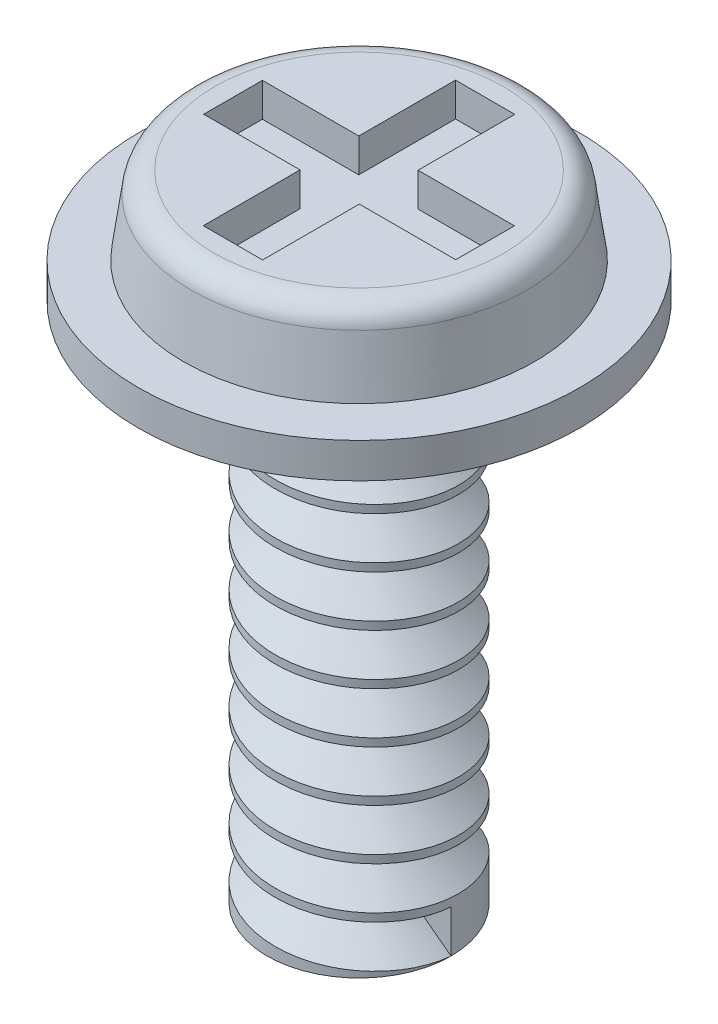
from build123d import *

# Parameters (mm, degrees)
SKETCH1_R           = 1.365
BOSS_EXTRUDE1_DEPTH = 7.74
SKETCH2_R           = 3.275
BOSS_EXTRUDE2_DEPTH = 0.52
SKETCH3_R           = 2.606427218
BOSS_EXTRUDE3_DEPTH = 1.16
CUT_EXTRUDE1_DEPTH  = 0.5
CUT_SWEEP1_PITCH    = 0.75


with BuildPart() as part:
    # Sketch1 → Boss-Extrude1 (new body)
    with BuildSketch(Plane(origin=(0, 0, 0), x_dir=(1, 0, 0), z_dir=(0, 1, 0))):
        with Locations(Location((0, 0, 0), (0, 0, 90))):
            Circle(SKETCH1_R)
    extrude(amount=BOSS_EXTRUDE1_DEPTH)

    # Sketch2 → Boss-Extrude2 (add)
    with BuildSketch(Plane(origin=(0, 7.74, 0), x_dir=(1, 0, 0), z_dir=(0, 1, 0))):
        with Locations(Location((0, 0, 0), (0, 0, 270))):
            Circle(SKETCH2_R)
    extrude(amount=BOSS_EXTRUDE2_DEPTH)

    # Sketch3 → Boss-Extrude3 (add)
    with BuildSketch(Plane(origin=(0, 8.26, 0), x_dir=(1, 0, 0), z_dir=(0, 1, 0))):
        with Locations(Location((0, 0, 0), (0, 0, 270))):
            Circle(SKETCH3_R)
    extrude(amount=BOSS_EXTRUDE3_DEPTH)

    # Sketch4 → Cut-Revolve1 (revolve, cut)
    with BuildSketch(Plane.XY, mode=Mode.PRIVATE) as cut_revolve1_sk:
        with BuildLine():
            Line((-2.606427218, 8.26), (-2.489205682, 9.119257272))
            ThreePointArc((-2.489205682, 9.119257272), (-2.37332232, 9.334239262), (-2.144649399, 9.42))
            Line((-2.144649399, 9.42), (-2.144649399, 9.50488178))
            Line((-2.144649399, 9.50488178), (-2.606427218, 9.50488178))
            Line((-2.606427218, 9.50488178), (-2.606427218, 8.26))
        make_face()
    revolve(cut_revolve1_sk.sketch.rotate(Axis((0, 10.113595236, 0), (0, -1, 0)), 270), axis=Axis((0, 10.113595236, 0), (0, -1, 0)), mode=Mode.SUBTRACT)

    # Sketch5 → Cut-Extrude1 (cut)
    with BuildSketch(Plane(origin=(0, 9.42, 0), x_dir=(1, 0, 0), z_dir=(0, 1, 0))):
        Polygon((-0.44, 1.871458961), (0.44, 1.871458961), (0.44, 0.435556945), (1.87, 0.435556945), (1.87, -0.435556945), (0.44, -0.435556945), (0.44, -1.871458961), (-0.44, -1.871458961), (-0.44, -0.435556945), (-1.87, -0.435556945), (-1.87, 0.435556945), (-0.44, 0.435556945), align=None)
    extrude(amount=-CUT_EXTRUDE1_DEPTH, mode=Mode.SUBTRACT)

    # Cut-Sweep1: arcs per turn and ends read off the stored shape
    # Cut-Sweep1: the profile of Sketch6 profile screwed along a left-hand helix through 9.5 turns, 8 arcs to a turn; built about Z, then put on its axis
    cut_sweep1_z = Axis((0, 0, 0), (0, 0, 1))
    cut_sweep1_corners = [(0, 1.3653, 0.631142424), (0, 0.924160681, 0.332678568), (0, 1.3653, -0.000226394)]
    with BuildLine(mode=Mode.PRIVATE) as cut_sweep1_profile:
        Line(cut_sweep1_corners[0], cut_sweep1_corners[1])
        Line(cut_sweep1_corners[1], cut_sweep1_corners[2])
        Line(cut_sweep1_corners[2], cut_sweep1_corners[0])
    cut_sweep1_cap = Face(cut_sweep1_profile.wire())
    cut_sweep1_turn_angles = [0, -22.5, -45, -67.5, -90, -112.5, -135, -157.5, -180, -202.5, -225, -247.5, -270, -292.5, -315, -337.5, -360]
    cut_sweep1_turn_weights = [1, 0.9238795325112867, 1, 0.9238795325112867, 1, 0.9238795325112867, 1, 0.9238795325112867, 1, 0.9238795325112867, 1, 0.9238795325112867, 1, 0.9238795325112867, 1, 0.9238795325112867, 1]
    cut_sweep1_turn_rails = [Edge.make_bspline([Vector(p[0], p[1], 0).rotate(cut_sweep1_z, cut_sweep1_turn_angles[k]) / cut_sweep1_turn_weights[k] + Vector(0, 0, p[2] + -CUT_SWEEP1_PITCH * cut_sweep1_turn_angles[k] / 360) for k in range(17)], [0, 0, 0, 1, 1, 2, 2, 3, 3, 4, 4, 5, 5, 6, 6, 7, 7, 8, 8, 8], 2, cut_sweep1_turn_weights) for p in cut_sweep1_corners]
    cut_sweep1_turn_sides = [Face.make_surface_from_curves(cut_sweep1_turn_rails[p[0]], cut_sweep1_turn_rails[p[1]]) for p in [(0, 1), (1, 2), (2, 0)]]
    cut_sweep1_last_angles = [-3240, -3262.5, -3285, -3307.5, -3330, -3352.5, -3375, -3397.5, -3420]
    cut_sweep1_last_weights = [1, 0.9238795325112867, 1, 0.9238795325112867, 1, 0.9238795325112867, 1, 0.9238795325112867, 1]
    cut_sweep1_last_rails = [Edge.make_bspline([Vector(p[0], p[1], 0).rotate(cut_sweep1_z, cut_sweep1_last_angles[k]) / cut_sweep1_last_weights[k] + Vector(0, 0, p[2] + -CUT_SWEEP1_PITCH * cut_sweep1_last_angles[k] / 360) for k in range(9)], [0, 0, 0, 1, 1, 2, 2, 3, 3, 4, 4, 4], 2, cut_sweep1_last_weights) for p in cut_sweep1_corners]
    cut_sweep1_last_sides = [Face.make_surface_from_curves(cut_sweep1_last_rails[p[0]], cut_sweep1_last_rails[p[1]]) for p in [(0, 1), (1, 2), (2, 0)]]
    cut_sweep1 = Plane(origin=(0, 0, 0), x_dir=(0, 0, 1), z_dir=(0, 1, 0)) * Solid(Shell([*[p.moved(Location((0, 0, CUT_SWEEP1_PITCH * i))) for i in range(9) for p in cut_sweep1_turn_sides], *cut_sweep1_last_sides, cut_sweep1_cap, cut_sweep1_cap.rotate(cut_sweep1_z, -3420).moved(Location((0, 0, -CUT_SWEEP1_PITCH * -3420 / 360)))]))
    add(cut_sweep1, mode=Mode.SUBTRACT)


solid = part.part
